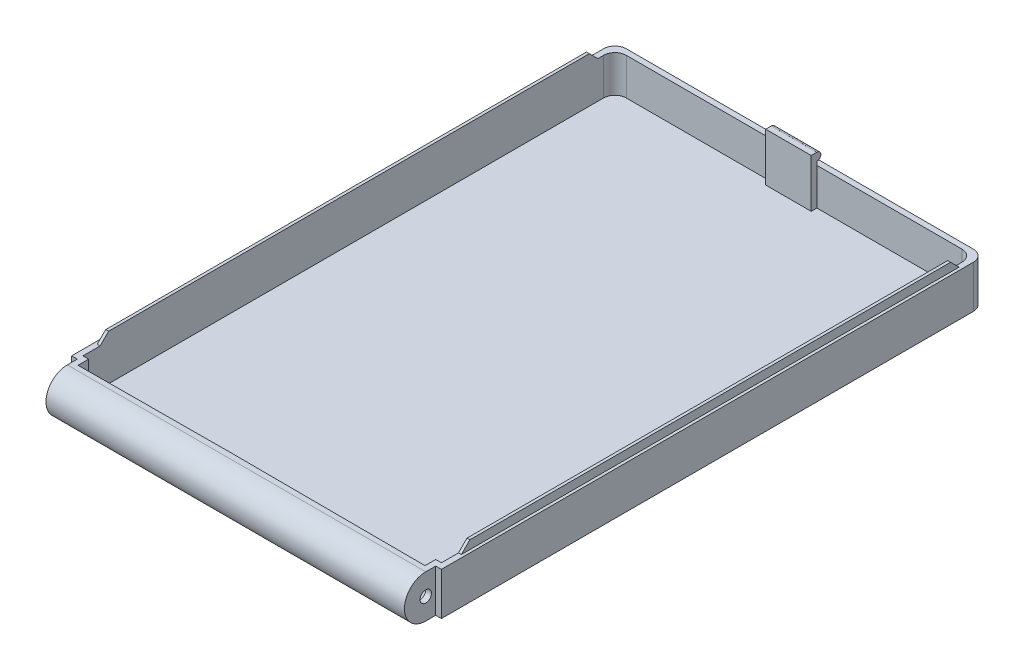
from build123d import *

# Parameters (mm, degrees)
SALIENTE_EXTRUIR2_DEPTH    = 15
CORTAR_EXTRUIR5_START      = -126
CORTAR_EXTRUIR5_DEPTH      = 126
CORTAR_EXTRUIR6_DEPTH      = 13
SALIENTE_EXTRUIR3_DEPTH    = 1
SALIENTE_EXTRUIR4_DEPTH    = 1
CORTAR_EXTRUIR7_DEPTH      = 122
SALIENTE_EXTRUIR5_DEPTH    = 2
SALIENTE_EXTRUIR6_DEPTH    = 16
CORTAR_EXTRUIR8_DEPTH      = 180
CORTAR_EXTRUIR8_DEPTH_BACK = 180
CROQUIS12_R                = 2


# Read off the part's stored shape, not the designer's step: Cortar-Extruir5
with BuildPart() as part:
    # Croquis1 → Saliente-Extruir2 (new body)
    with BuildSketch(Plane(origin=(0, 0, 0), x_dir=(1, 0, 0), z_dir=(0, 1, 0))):
        with BuildLine():
            Line((0, 0), (2, 0))
            Line((2, 0), (2, -11))
            Line((2, -11), (128, -11))
            Line((128, -11), (128, 0))
            Line((128, 0), (130, 0))
            Line((130, 0), (130, 187))
            ThreePointArc((130, 187), (128.828427125, 189.828427125), (126, 191))
            Line((126, 191), (4, 191))
            ThreePointArc((4, 191), (1.171572875, 189.828427125), (0, 187))
            Line((0, 187), (0, 0))
        make_face()
    extrude(amount=SALIENTE_EXTRUIR2_DEPTH)

    # Cortar-Extruir5 outline → Cortar-Extruir5 (cut)
    with BuildSketch(Plane(origin=(128, 0, 0), x_dir=(0, 0, -1), z_dir=(1, 0, 0)).offset(CORTAR_EXTRUIR5_START)):
        with BuildLine():
            Line((-11, 0), (-3.5, 0))
            ThreePointArc((-3.5, 0), (-8.803300859, 2.196699141), (-11, 7.5))
            Line((-11, 7.5), (-11, 0))
        make_face()
        with BuildLine():
            Line((-11, 15), (-11, 7.5))
            ThreePointArc((-11, 7.5), (-8.803300859, 12.803300859), (-3.5, 15))
            Line((-3.5, 15), (-11, 15))
        make_face()
    extrude(amount=CORTAR_EXTRUIR5_DEPTH, mode=Mode.SUBTRACT)

    # Croquis3 → Cortar-Extruir6 (cut)
    with BuildSketch(Plane(origin=(0, 15, 0), x_dir=(1, 0, 0), z_dir=(0, 1, 0))):
        with BuildLine():
            Line((2, 80.037921952), (2, 185))
            ThreePointArc((2, 185), (3.171572875, 187.828427125), (6, 189))
            Line((6, 189), (124, 189))
            ThreePointArc((124, 189), (126.828427125, 187.828427125), (128, 185))
            Line((128, 185), (128, 95.850744251))
            Line((128, 95.850744251), (128, 2))
            Line((128, 2), (126, 2))
            Line((126, 2), (126, -1.75))
            Line((126, -1.75), (57.409845297, -1.5))
            Line((57.409845297, -1.5), (4, -1.75))
            Line((4, -1.75), (4, 2))
            Line((4, 2), (2, 2))
            Line((2, 2), (2, 80.037921952))
        make_face()
    extrude(amount=-CORTAR_EXTRUIR6_DEPTH, mode=Mode.SUBTRACT)

    # Croquis6 → Saliente-Extruir3 (add)
    with BuildSketch(Plane.ZY.offset(-128)):
        Polygon((-183, 15), (-8, 15), (-11, 18), (-180, 18), align=None)
    extrude(amount=-SALIENTE_EXTRUIR3_DEPTH)

    # Croquis7 → Saliente-Extruir4 (add)
    with BuildSketch(Plane(origin=(2, 0, 0), x_dir=(0, 0, -1), z_dir=(1, 0, 0))):
        Polygon((183, 15), (180, 18), (11, 18), (8, 15), align=None)
    extrude(amount=-SALIENTE_EXTRUIR4_DEPTH)

    # Croquis8 → Cortar-Extruir7 (cut)
    with BuildSketch(Plane(origin=(4, 0, 0), x_dir=(0, 0, -1), z_dir=(1, 0, 0))):
        with BuildLine():
            Line((-3.5, 13), (5.32233659, 13))
            Line((5.32233659, 13), (5.32233659, 2))
            Line((5.32233659, 2), (-3.5, 2))
            ThreePointArc((-3.5, 2), (-9, 7.5), (-3.5, 13))
        make_face()
    extrude(amount=CORTAR_EXTRUIR7_DEPTH, mode=Mode.SUBTRACT)

    # Croquis10 → Saliente-Extruir5 (add)
    with BuildSketch(Plane.XY.offset(-189)):
        Polygon((65, 2), (73, 2), (73, 19), (72.859656946, 19), (57, 19), (57, 2), align=None)
    extrude(amount=SALIENTE_EXTRUIR5_DEPTH)

    # Croquis11 → Saliente-Extruir6 (add)
    with BuildSketch(Plane(origin=(73, 0, 0), x_dir=(0, 0, -1), z_dir=(1, 0, 0))):
        with BuildLine():
            Line((189, 19.00862759), (189, 16.20862759))
            ThreePointArc((189, 16.20862759), (190.4, 17.60862759), (189, 19.00862759))
        make_face()
    extrude(amount=-SALIENTE_EXTRUIR6_DEPTH)

    # Croquis12 → Cortar-Extruir8 (cut, two sides: drawn at the far end of the back side and taken through both)
    with BuildSketch(Plane(origin=(4, 0, 0), x_dir=(0, 0, -1), z_dir=(1, 0, 0)).offset(-CORTAR_EXTRUIR8_DEPTH_BACK)):
        with Locations(Location((-3.5, 7.5, 0), (0, 0, 180))):
            Circle(CROQUIS12_R)
    extrude(amount=CORTAR_EXTRUIR8_DEPTH + CORTAR_EXTRUIR8_DEPTH_BACK, mode=Mode.SUBTRACT)


solid = part.part
